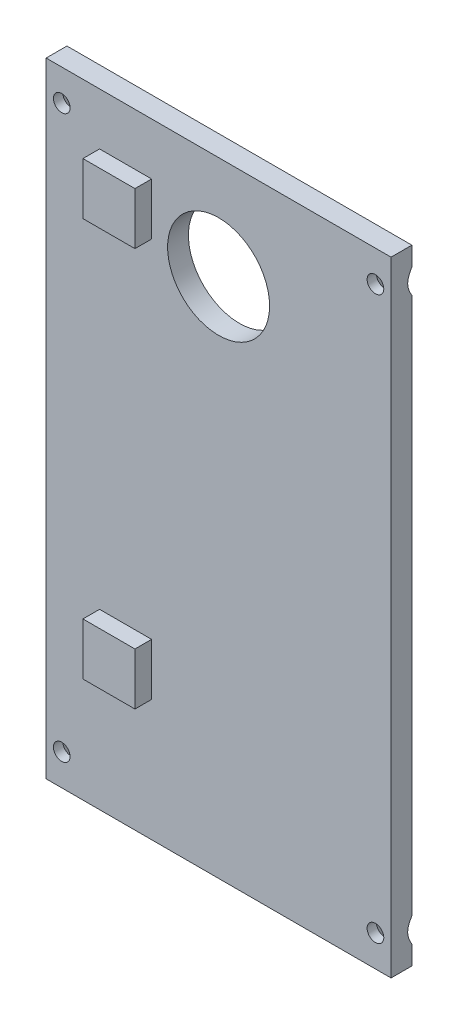
from build123d import *

# Parameters (mm, degrees)
SKETCH1_W           = 33.15
SKETCH1_H           = 60
SKETCH1_R           = 4.9
BOSS_EXTRUDE1_DEPTH = 2
SKETCH3_W           = 5
SKETCH3_H           = 5
BOSS_EXTRUDE2_DEPTH = 1.6
SKETCH4_R           = 0.8
CUT_EXTRUDE1_DEPTH  = 2
CHAMFER1_SIZE       = 1.1


with BuildPart() as part:
    # Sketch1 → Boss-Extrude1 (new body)
    with BuildSketch(Plane.XY):
        Rectangle(SKETCH1_W, SKETCH1_H)
        with Locations((0, 20.1)):
            Circle(SKETCH1_R, mode=Mode.SUBTRACT)
    extrude(amount=BOSS_EXTRUDE1_DEPTH)

    # Sketch3 → Boss-Extrude2 (add)
    with BuildSketch(Plane.XY.offset(2)):
        with Locations((-8.94, 22.5)):
            Rectangle(SKETCH3_W, SKETCH3_H)
        with Locations((-8.94, -15.82)):
            Rectangle(SKETCH3_W, SKETCH3_H)
    extrude(amount=BOSS_EXTRUDE2_DEPTH)

    # Sketch4 → Cut-Extrude1 (cut)
    with BuildSketch(Plane(origin=(0, 0, 0), x_dir=(-1, 0, 0), z_dir=(0, 0, -1))):
        with Locations((-15.075, 27)):
            Circle(SKETCH4_R)
        with Locations((15.075, 27)):
            Circle(SKETCH4_R)
        with Locations((15.075, -27)):
            Circle(SKETCH4_R)
        with Locations((-15.075, -27)):
            Circle(SKETCH4_R)
    extrude(amount=-CUT_EXTRUDE1_DEPTH, mode=Mode.SUBTRACT)

    # Chamfer1
    # the kernel refuses this chamfer: 1.1 mm, written as the material it takes off along each edge
    with BuildSketch(Plane(origin=(15.075, -27, 0), x_dir=(-1, 0, 0), z_dir=(0, -1, 0))) as chamfer1_piece_1:
        Polygon((0.8 + CHAMFER1_SIZE, 0), (0.8, -CHAMFER1_SIZE), (0.8, 0), align=None)
    revolve(axis=Axis((15.075, -27, 0), (0, 0, -1)), mode=Mode.SUBTRACT)
    with BuildSketch(Plane(origin=(-15.075, -27, 0), x_dir=(-1, 0, 0), z_dir=(0, -1, 0))) as chamfer1_piece_2:
        Polygon((0.8 + CHAMFER1_SIZE, 0), (0.8, -CHAMFER1_SIZE), (0.8, 0), align=None)
    revolve(axis=Axis((-15.075, -27, 0), (0, 0, -1)), mode=Mode.SUBTRACT)
    with BuildSketch(Plane(origin=(-15.075, 27, 0), x_dir=(-1, 0, 0), z_dir=(0, -1, 0))) as chamfer1_piece_3:
        Polygon((0.8 + CHAMFER1_SIZE, 0), (0.8, -CHAMFER1_SIZE), (0.8, 0), align=None)
    revolve(axis=Axis((-15.075, 27, 0), (0, 0, -1)), mode=Mode.SUBTRACT)
    with BuildSketch(Plane(origin=(15.075, 27, 0), x_dir=(-1, 0, 0), z_dir=(0, -1, 0))) as chamfer1_piece_4:
        Polygon((0.8 + CHAMFER1_SIZE, 0), (0.8, -CHAMFER1_SIZE), (0.8, 0), align=None)
    revolve(axis=Axis((15.075, 27, 0), (0, 0, -1)), mode=Mode.SUBTRACT)


solid = part.part
